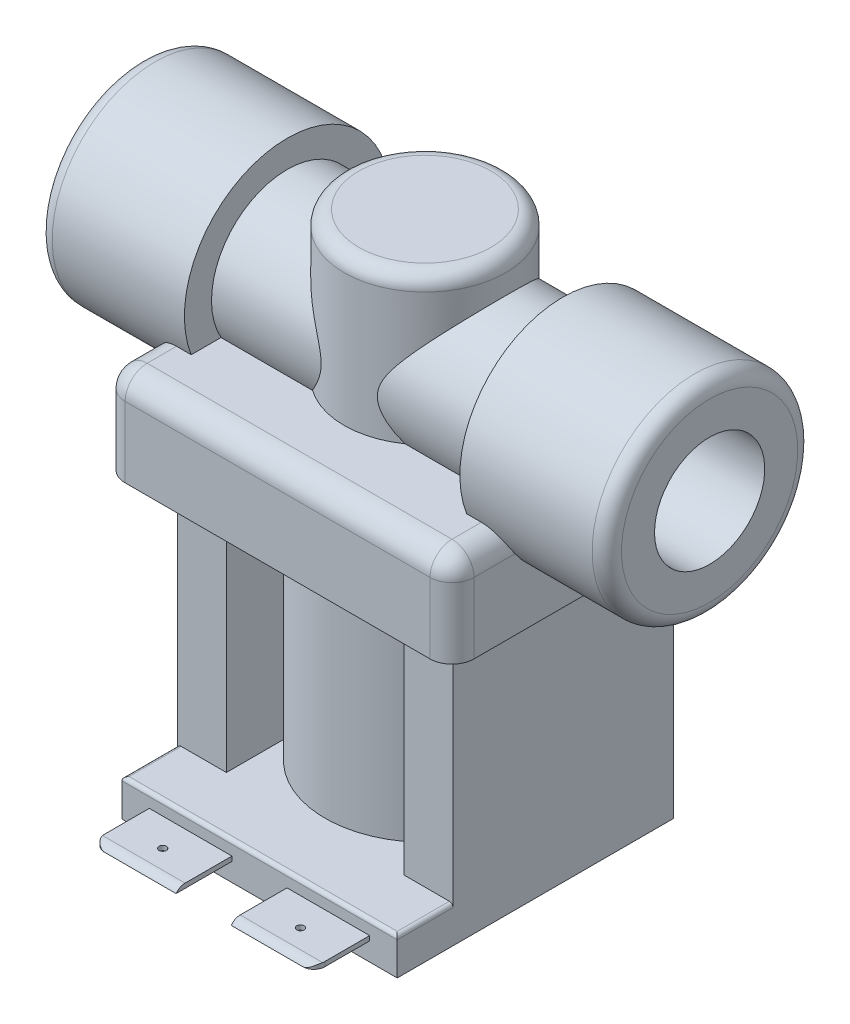
from build123d import *

# Parameters (mm, degrees)
SKETCH1_W                = 19.05
SKETCH1_H                = 19.05
BOSS_EXTRUDE1_DEPTH      = 15.24
SKETCH2_W                = 19.05
SKETCH2_H                = 2.54
BOSS_EXTRUDE2_DEPTH      = 3.8608
SKETCH3_W                = 5.715
SKETCH3_H                = 0.317516884
BOSS_EXTRUDE3_DEPTH      = 3.8608
SKETCH4_R                = 0.254
CUT_EXTRUDE1_DEPTH       = 3.8608
CUT_EXTRUDE2_DEPTH       = 16.51
BOSS_EXTRUDE4_DEPTH      = 10.16
BOSS_EXTRUDE4_DEPTH_BACK = 29.21
SKETCH6_W                = 15.312192665
SKETCH6_H                = 16.51
SKETCH7_OUTSIDE_W        = 36.524
SKETCH7_OUTSIDE_H        = 49.122
SKETCH7_OUTSIDE_R        = 7.112
CUT_EXTRUDE3_DEPTH       = 10.16
SKETCH8_OUTSIDE_W        = 36.524
SKETCH8_OUTSIDE_H        = 49.122
SKETCH8_OUTSIDE_R        = 7.112
CUT_EXTRUDE4_DEPTH       = 10.16
SKETCH9_W                = 19.05
SKETCH9_H                = 15.312192665
SKETCH9_R                = 5.588
CUT_EXTRUDE6_DEPTH       = 10.16
SKETCH10_R               = 5.238445082
BOSS_EXTRUDE5_DEPTH      = 20.32
BOSS_EXTRUDE6_DEPTH      = 2.54
BOSS_EXTRUDE6_DEPTH_BACK = 17.78
SKETCH11_W               = 19.05
SKETCH11_H               = 6.35
FILLET1_R                = 1.524
FILLET2_R                = 1.016
FILLET3_R                = 1.016
FILLET5_R                = 0.762
FILLET6_R                = 0.254
SKETCH12_R               = 3.81
CUT_EXTRUDE7_DEPTH       = 58.807833199


with BuildPart() as part:
    # Sketch1 → Boss-Extrude1 (new body)
    with BuildSketch(Plane.XY):
        with Locations((9.525, 9.525)):
            Rectangle(SKETCH1_W, SKETCH1_H)
    extrude(amount=BOSS_EXTRUDE1_DEPTH)

    # Sketch2 → Boss-Extrude2 (add)
    with BuildSketch(Plane.XY.offset(15.24)):
        with Locations((9.525, 1.27)):
            Rectangle(SKETCH2_W, SKETCH2_H)
    extrude(amount=BOSS_EXTRUDE2_DEPTH)

    # Sketch3 → Boss-Extrude3 (add)
    with BuildSketch(Plane.XY.offset(19.1008)):
        with Locations((14.2875, 1.428758442)):
            Rectangle(SKETCH3_W, SKETCH3_H)
        with Locations((4.7625, 1.428758442)):
            Rectangle(SKETCH3_W, SKETCH3_H)
    extrude(amount=BOSS_EXTRUDE3_DEPTH)

    # Sketch4 → Cut-Extrude1 (cut)
    with BuildSketch(Plane(origin=(0, 1.587516884, 0), x_dir=(1, 0, 0), z_dir=(0, 1, 0))):
        with Locations(Location((4.7625, -21.0312, 0), (0, 0, 180))):
            Circle(SKETCH4_R)
        with Locations(Location((14.2875, -21.0312, 0), (0, 0, 180))):
            Circle(SKETCH4_R)
    extrude(amount=-CUT_EXTRUDE1_DEPTH, mode=Mode.SUBTRACT)

    # Sketch5 → Cut-Extrude2 (cut)
    with BuildSketch(Plane(origin=(0, 19.05, 0), x_dir=(1, 0, 0), z_dir=(0, 1, 0))):
        with BuildLine():
            ThreePointArc((15.673821391, -10.861568969), (13.115527413, -13.571796937), (9.525, -14.57095489))
            Line((9.525, -14.57095489), (9.525, -15.24))
            Line((9.525, -15.24), (15.673821391, -15.24))
            Line((15.673821391, -15.24), (15.673821391, -10.861568969))
        make_face()
        with BuildLine():
            ThreePointArc((9.525, -14.57095489), (5.934472587, -13.571796937), (3.376178609, -10.861568969))
            Line((3.376178609, -10.861568969), (3.376178609, -15.24))
            Line((3.376178609, -15.24), (9.525, -15.24))
            Line((9.525, -15.24), (9.525, -14.57095489))
        make_face()
        with BuildLine():
            Line((9.525, 0), (3.376178609, 0))
            Line((3.376178609, 0), (3.376178609, -4.378431031))
            ThreePointArc((3.376178609, -4.378431031), (5.934472587, -1.668203063), (9.525, -0.66904511))
            Line((9.525, -0.66904511), (9.525, 0))
        make_face()
        with BuildLine():
            Line((15.673821391, 0), (9.525, 0))
            Line((9.525, 0), (9.525, -0.66904511))
            ThreePointArc((9.525, -0.66904511), (13.115527413, -1.668203063), (15.673821391, -4.378431031))
            Line((15.673821391, -4.378431031), (15.673821391, 0))
        make_face()
    extrude(amount=-CUT_EXTRUDE2_DEPTH, mode=Mode.SUBTRACT)

    # Sketch6 → Boss-Extrude4 (add, two sides: drawn at the far end of the back side and taken through both)
    with BuildSketch(Plane.ZY.offset(-BOSS_EXTRUDE4_DEPTH_BACK)):
        with Locations((7.656096333, 27.305)):
            Rectangle(SKETCH6_W, SKETCH6_H)
    extrude(amount=BOSS_EXTRUDE4_DEPTH + BOSS_EXTRUDE4_DEPTH_BACK)

    # Sketch7 outside → Cut-Extrude3 (cut)
    with BuildSketch(Plane.ZY.offset(10.16)):
        with Locations((11.481, 17.78)):
            Rectangle(SKETCH7_OUTSIDE_W, SKETCH7_OUTSIDE_H)
        with Locations((7.656096333, 27.94)):
            Circle(SKETCH7_OUTSIDE_R, mode=Mode.SUBTRACT)
    extrude(amount=-CUT_EXTRUDE3_DEPTH, mode=Mode.SUBTRACT)

    # Sketch8 outside → Cut-Extrude4 (cut)
    with BuildSketch(Plane(origin=(29.21, 0, 0), x_dir=(0, 0, -1), z_dir=(1, 0, 0))):
        with Locations((-11.481, 17.78)):
            Rectangle(SKETCH8_OUTSIDE_W, SKETCH8_OUTSIDE_H)
        with Locations(Location((-7.656096333, 27.94, 0), (0, 0, 180))):
            Circle(SKETCH8_OUTSIDE_R, mode=Mode.SUBTRACT)
    extrude(amount=-CUT_EXTRUDE4_DEPTH, mode=Mode.SUBTRACT)

    # Sketch9 → Cut-Extrude6 (cut)
    with BuildSketch(Plane(origin=(0, 35.56, 0), x_dir=(1, 0, 0), z_dir=(0, 1, 0))):
        with Locations((9.525, -7.656096333)):
            Rectangle(SKETCH9_W, SKETCH9_H)
        with Locations(Location((9.525, -7.656096333, 0), (0, 0, 270))):
            Circle(SKETCH9_R, mode=Mode.SUBTRACT)
    extrude(amount=-CUT_EXTRUDE6_DEPTH, mode=Mode.SUBTRACT)

    # Sketch10 → Boss-Extrude5 (add)
    with BuildSketch(Plane(origin=(0, 0, 0), x_dir=(0, 0, -1), z_dir=(1, 0, 0))):
        with Locations((-7.656096333, 27.94)):
            Circle(SKETCH10_R)
    extrude(amount=BOSS_EXTRUDE5_DEPTH)

    # Sketch11 → Boss-Extrude6 (add, two sides: drawn at the far end of the back side and taken through both)
    with BuildSketch(Plane.XY.offset(15.312192665).offset(-BOSS_EXTRUDE6_DEPTH_BACK)):
        with Locations((9.525, 22.225)):
            Rectangle(SKETCH11_W, SKETCH11_H)
        Polygon((0, 19.05), (0, 25.4), (-2.54, 25.4), (-2.54, 18.996030985), (0, 18.996030985), align=None)
        Polygon((21.59, 25.4), (19.05, 25.4), (19.05, 19.05), (0, 19.05), (0, 18.996030985), (21.59, 18.996030985), align=None)
    extrude(amount=BOSS_EXTRUDE6_DEPTH + BOSS_EXTRUDE6_DEPTH_BACK)

    # Fillet1
    fillet1_edges = [part.edges().sort_by_distance(p)[0] for p in [
        (-2.54, 25.4, 16.075625494),
        (9.525, 25.4, -2.467807335),
        (-2.54, 25.4, -0.727336496),
        (-2.54, 22.198015493, -2.467807335),
        (21.59, 25.4, 16.075625494),
        (21.59, 22.198015493, 17.852192665),
        (21.59, 25.4, -0.727336496),
        (21.59, 22.198015493, -2.467807335),
        (9.525, 25.4, 17.852192665),
        (-2.54, 22.198015493, 17.852192665),
    ]]
    fillet(fillet1_edges, radius=FILLET1_R)

    # Fillet2
    fillet2_edges = [part.edges().sort_by_distance(p)[0] for p in [
        (9.525, 35.56, 2.068096333),
    ]]
    fillet(fillet2_edges, radius=FILLET2_R)

    # Fillet3
    fillet3_edges = [part.edges().sort_by_distance(p)[0] for p in [
        (-10.16, 27.94, 0.544096333),
        (29.21, 27.94, 0.544096333),
    ]]
    fillet(fillet3_edges, radius=FILLET3_R)

    # Fillet5
    # the kernel refuses this fillet: 0.762 mm, written as the material it takes off along each edge
    with BuildSketch(Plane(origin=(17.145, 3.492516884, 22.9616), x_dir=(0, 0, -1), z_dir=(0, -1, 0)), Plane(origin=(1.905, -0.635, 22.9616), x_dir=(0, 0, -1), z_dir=(0, 1, 0))) as fillet5_piece_1:
        with BuildLine():
            CenterArc((FILLET5_R, -FILLET5_R), FILLET5_R, 90, 90)
            Line((0, -FILLET5_R), (-FILLET5_R * 0.02, -FILLET5_R))
            Line((-FILLET5_R * 0.02, -FILLET5_R), (-FILLET5_R * 0.02, FILLET5_R * 0.02))
            Line((-FILLET5_R * 0.02, FILLET5_R * 0.02), (FILLET5_R, FILLET5_R * 0.02))
            Line((FILLET5_R, FILLET5_R * 0.02), (FILLET5_R, 0))
        make_face()
    fillet5_piece_1_solid = extrude(amount=4.127516884, mode=Mode.PRIVATE)
    with BuildSketch(Plane(origin=(9.882666084, 1.587516884, 22.9616), x_dir=(0, 0, -1), z_dir=(1, 0, 0)), Plane(origin=(0.357666084, 1.587516884, 22.9616), x_dir=(0, 0, -1), z_dir=(1, 0, 0))) as fillet5_piece_2:
        with BuildLine():
            CenterArc((0.618933566, -0.762), FILLET5_R, 90, 54.316228291)
            Line((0, -0.317516884), (-0.012378671, -0.308627222))
            ThreePointArc((-0.012378671, -0.308627222), (-0.01524, -0.158758442), (-0.01524, 0))
            Line((-0.01524, 0), (0, 0.01524))
            Line((0, 0.01524), (0.618933566, 0.01524))
            Line((0.618933566, 0.01524), (0.618933566, 0))
        make_face()
    fillet5_piece_2_solid = extrude(amount=8.809667832, mode=Mode.PRIVATE)
    add([fillet5_piece_1_solid, fillet5_piece_2_solid], mode=Mode.SUBTRACT)

    # Fillet6
    fillet6_edges = [part.edges().sort_by_distance(p)[0] for p in [
        (0, 2.54, 17.1704),
        (19.05, 2.54, 17.1704),
        (9.525, 2.54, 19.1008),
        (9.525, 2.54, 0),
    ]]
    fillet(fillet6_edges, radius=FILLET6_R)

    # Sketch12 → Cut-Extrude7 (cut, through all)
    with BuildSketch(Plane.ZY.offset(10.16)):
        with Locations((7.656096333, 27.94)):
            Circle(SKETCH12_R)
    extrude(amount=-CUT_EXTRUDE7_DEPTH, mode=Mode.SUBTRACT)


solid = part.part
